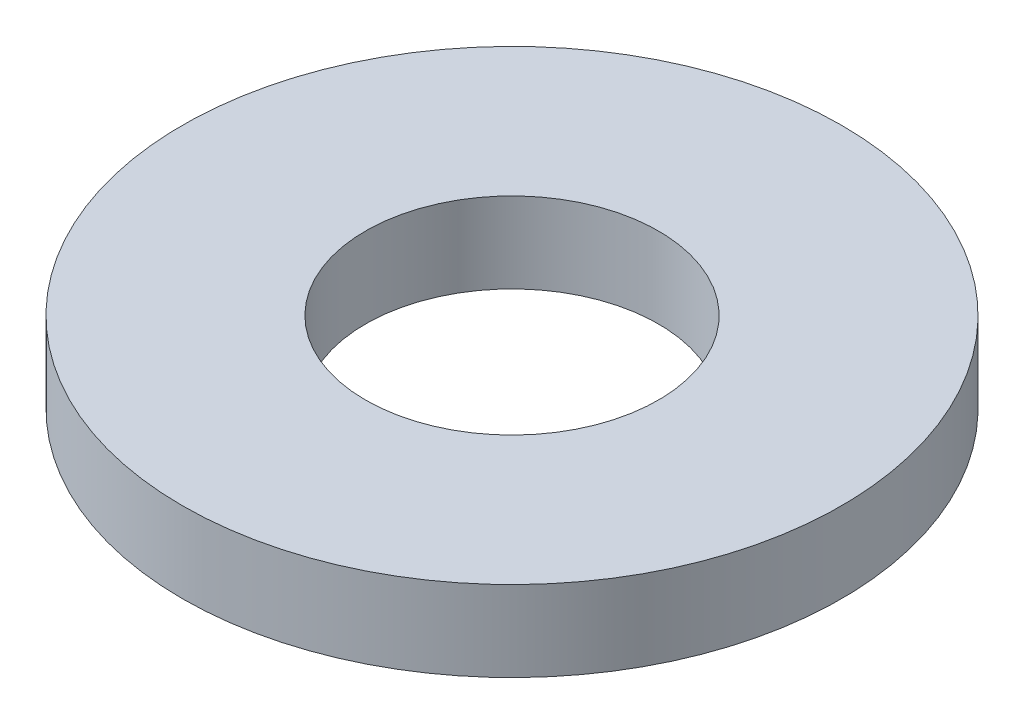
from build123d import *

# Parameters (mm, degrees)
SKETCH1_R           = 45
BOSS_EXTRUDE1_DEPTH = 11
SKETCH2_R           = 20
CUT_EXTRUDE1_DEPTH  = 65.58327957


with BuildPart() as part:
    # Sketch1 → Boss-Extrude1 (new body)
    with BuildSketch(Plane(origin=(0, 0, 0), x_dir=(1, 0, 0), z_dir=(0, 1, 0))):
        Circle(SKETCH1_R)
    extrude(amount=BOSS_EXTRUDE1_DEPTH)

    # Sketch2 → Cut-Extrude1 (cut, through all)
    with BuildSketch(Plane(origin=(0, 0, 0), x_dir=(1, 0, 0), z_dir=(0, 1, 0))):
        Circle(SKETCH2_R)
    extrude(amount=CUT_EXTRUDE1_DEPTH, mode=Mode.SUBTRACT)


solid = part.part
